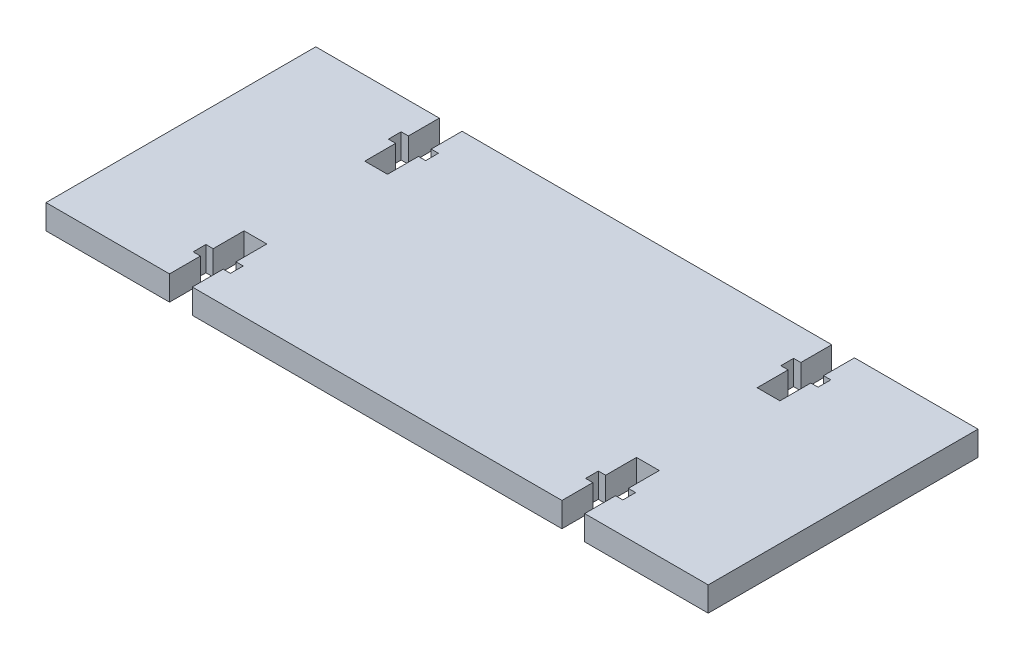
from build123d import *

# Parameters (mm, degrees)
SKETCH1_W           = 85.725
SKETCH1_H           = 34.925
BOSS_EXTRUDE1_DEPTH = 3.175
CUT_EXTRUDE2_DEPTH  = 47.391954448


with BuildPart() as part:
    # Sketch1 → Boss-Extrude1 (new body)
    with BuildSketch(Plane(origin=(0, 0, 0), x_dir=(1, 0, 0), z_dir=(0, 1, 0))):
        Rectangle(SKETCH1_W, SKETCH1_H)
    extrude(amount=BOSS_EXTRUDE1_DEPTH)

    # Sketch3 → Cut-Extrude2 (cut, through all)
    with BuildSketch(Plane.XZ):
        Polygon((-26.8732, 17.4625), (-23.9268, 17.4625), (-23.9268, 13.462), (-22.987, 13.462), (-22.987, 11.811), (-23.9268, 11.811), (-23.9268, 7.8105), (-26.8732, 7.8105), (-26.8732, 11.811), (-27.813, 11.811), (-27.813, 13.462), (-26.8732, 13.462), align=None)
        Polygon((26.8732, 11.811), (26.8732, 7.8105), (23.9268, 7.8105), (23.9268, 11.811), (22.987, 11.811), (22.987, 13.462), (23.9268, 13.462), (23.9268, 17.4625), (26.8732, 17.4625), (26.8732, 13.462), (27.813, 13.462), (27.813, 11.811), align=None)
        Polygon((26.8732, -17.4625), (23.9268, -17.4625), (23.9268, -13.462), (22.987, -13.462), (22.987, -11.811), (23.9268, -11.811), (23.9268, -7.8105), (26.8732, -7.8105), (26.8732, -11.811), (27.813, -11.811), (27.813, -13.462), (26.8732, -13.462), align=None)
        Polygon((-26.8732, -11.811), (-26.8732, -7.8105), (-23.9268, -7.8105), (-23.9268, -11.811), (-22.987, -11.811), (-22.987, -13.462), (-23.9268, -13.462), (-23.9268, -17.4625), (-26.8732, -17.4625), (-26.8732, -13.462), (-27.813, -13.462), (-27.813, -11.811), align=None)
    extrude(amount=-CUT_EXTRUDE2_DEPTH, mode=Mode.SUBTRACT)


solid = part.part
